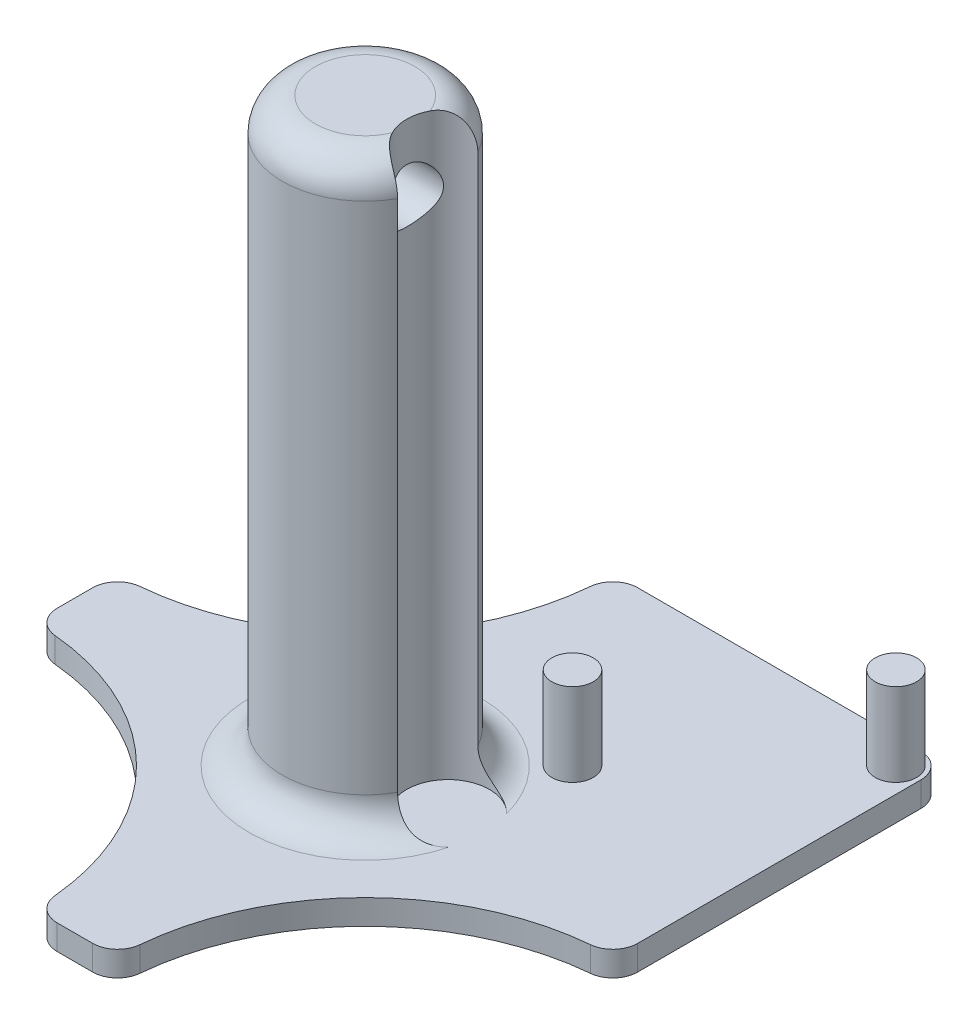
from build123d import *

# Parameters (mm, degrees)
BOSS_EXTRUDE1_DEPTH = 3
FILLET1_R           = 3
SKETCH2_R           = 10
BOSS_EXTRUDE3_DEPTH = 70
SKETCH4_R           = 2.5
CUT_EXTRUDE2_DEPTH  = 70
SKETCH7_R           = 3.25
CUT_EXTRUDE3_DEPTH  = 38
FILLET3_R           = 4
SKETCH8_R           = 5
CUT_EXTRUDE4_DEPTH  = 70
SKETCH10_W          = 35
SKETCH10_H          = 35
BOSS_EXTRUDE5_DEPTH = 3
FILLET5_R           = 3
SKETCH11_R          = 2.5
BOSS_EXTRUDE6_DEPTH = 10
FILLET6_R           = 4


with BuildPart() as part:
    # Sketch1 → Boss-Extrude1 (new body)
    with BuildSketch(Plane(origin=(0, 0, 0), x_dir=(1, 0, 0), z_dir=(0, 1, 0))):
        with BuildLine():
            ThreePointArc((0, 30), (21.213203436, 21.213203436), (30, 0))
            Line((30, 0), (40, 0))
            ThreePointArc((40, 0), (48.786796564, 21.213203436), (70, 30))
            Line((70, 30), (70, 40))
            ThreePointArc((70, 40), (48.786796564, 48.786796564), (40, 70))
            Line((40, 70), (30, 70))
            ThreePointArc((30, 70), (21.213203436, 48.786796564), (0, 40))
            Line((0, 40), (0, 30))
        make_face()
    extrude(amount=BOSS_EXTRUDE1_DEPTH)

    # Fillet1
    fillet1_edges = [part.edges().sort_by_distance(p)[0] for p in [
        (70, 1.5, -40),
        (70, 1.5, -30),
        (40, 1.5, 0),
        (30, 1.5, 0),
        (0, 1.5, -30),
        (0, 1.5, -40),
        (30, 1.5, -70),
        (40, 1.5, -70),
    ]]
    fillet(fillet1_edges, radius=FILLET1_R)

    # Sketch2 → Boss-Extrude3 (add)
    with BuildSketch(Plane(origin=(0, 3, 0), x_dir=(1, 0, 0), z_dir=(0, 1, 0))):
        with Locations(Location((35, 35, 0), (0, 0, 270))):
            Circle(SKETCH2_R)
    extrude(amount=BOSS_EXTRUDE3_DEPTH)

    # Sketch4 → Cut-Extrude2 (cut)
    with BuildSketch(Plane(origin=(70, 0, 0), x_dir=(0, 0, -1), z_dir=(1, 0, 0))):
        with Locations((35, 65)):
            Circle(SKETCH4_R)
    extrude(amount=-CUT_EXTRUDE2_DEPTH, mode=Mode.SUBTRACT)

    # Sketch7 → Cut-Extrude3 (cut)
    with BuildSketch(Plane(origin=(70, 0, 0), x_dir=(0, 0, -1), z_dir=(1, 0, 0))):
        with Locations((35, 65)):
            Circle(SKETCH7_R)
    extrude(amount=-CUT_EXTRUDE3_DEPTH, mode=Mode.SUBTRACT)

    # Fillet3
    fillet3_edges = [part.edges().sort_by_distance(p)[0] for p in [
        (35, 73, -45),
    ]]
    fillet(fillet3_edges, radius=FILLET3_R)

    # Sketch8 → Cut-Extrude4 (cut)
    with BuildSketch(Plane(origin=(0, 73, 0), x_dir=(1, 0, 0), z_dir=(0, 1, 0))):
        with Locations((45, 35)):
            Circle(SKETCH8_R)
    extrude(amount=-CUT_EXTRUDE4_DEPTH, mode=Mode.SUBTRACT)

    # Sketch10 → Boss-Extrude5 (add)
    with BuildSketch(Plane(origin=(0, 3, 0), x_dir=(1, 0, 0), z_dir=(0, 1, 0))):
        with Locations((52.5, 52.5)):
            Rectangle(SKETCH10_W, SKETCH10_H)
    extrude(amount=-BOSS_EXTRUDE5_DEPTH)

    # Fillet5
    fillet5_edges = [part.edges().sort_by_distance(p)[0] for p in [
        (70, 1.5, -70),
    ]]
    fillet(fillet5_edges, radius=FILLET5_R)

    # Sketch11 → Boss-Extrude6 (add)
    with BuildSketch(Plane(origin=(0, 3, 0), x_dir=(1, 0, 0), z_dir=(0, 1, 0))):
        with Locations(Location((67, 67, 0), (0, 0, 270))):
            Circle(SKETCH11_R)
        with Locations(Location((47.5, 47.5, 0), (0, 0, 270))):
            Circle(SKETCH11_R)
    extrude(amount=BOSS_EXTRUDE6_DEPTH)

    # Fillet6
    # the kernel refuses this fillet: 4 mm, written as the material it adds along each edge
    with BuildSketch(Plane(origin=(35, 3, -35), x_dir=(0.9999950652018581, 0, -0.0031415874858794265), z_dir=(0.0031415874858794265, 0, 0.9999950652018581))) as fillet6_piece_1_section:
        with BuildLine():
            CenterArc((10 + FILLET6_R, FILLET6_R), FILLET6_R, 180, 90)
            Line((10, FILLET6_R), (10, 0))
            Line((10, 0), (10 + FILLET6_R, 0))
        make_face()
    fillet6_piece_1 = revolve(axis=Axis((35, 3, -35), (0, 1, 0)), revolution_arc=359.64, mode=Mode.PRIVATE)
    fillet6_piece_1 = fillet6_piece_1 - Plane(origin=(45, 4.127744663, -35), x_dir=(1, 0, 0), z_dir=(0, 1, 0)) * Cylinder(5, 56, mode=Mode.PRIVATE)
    add(fillet6_piece_1)


solid = part.part
